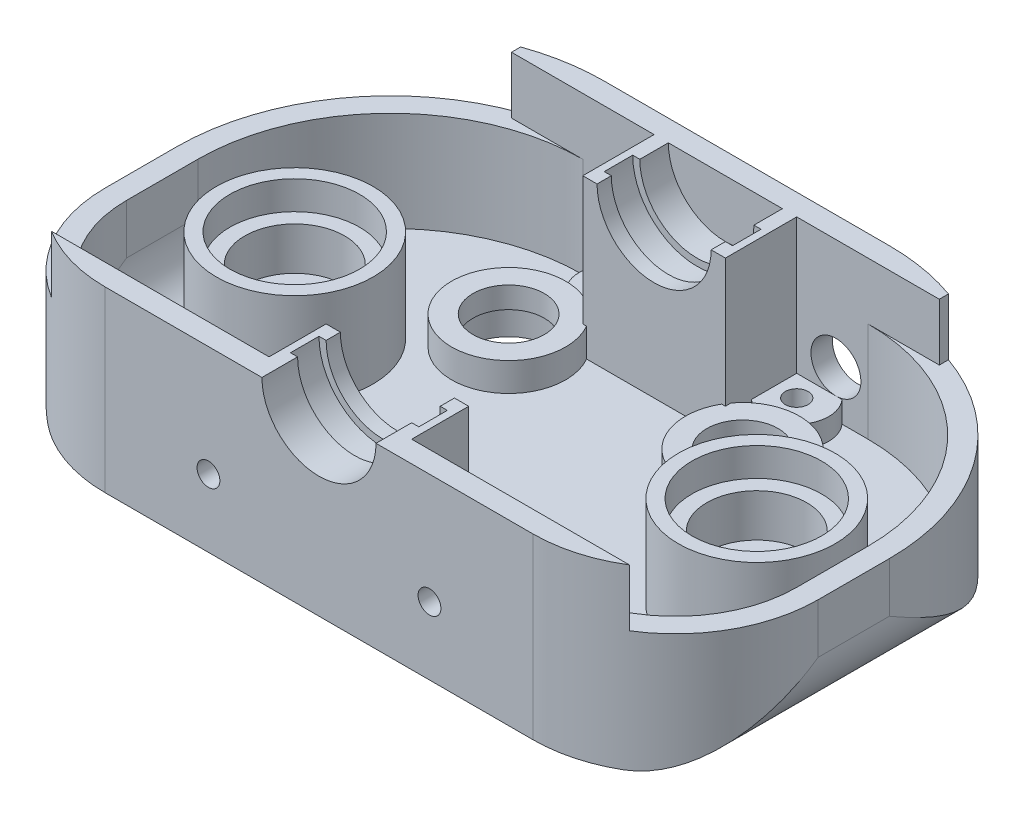
from build123d import *

# Parameters (mm, degrees)
SKETCH_1_W                = 100
SKETCH_1_H                = 60
EXTRUDE_1_DEPTH           = 25
FILLET_2_R                = 10
FILLET_1_R                = 20
FILLET_3_R                = 30
SHELL_1_T                 = -3
CUT_EXTRUDE_1_DEPTH       = 80.837334801
CUT_EXTRUDE_1_DEPTH_BACK  = 80.837334801
SKETCH_2_R                = 1.6
SKETCH_3_W                = 54
SKETCH_3_H                = 10.68528909
CUT_EXTRUDE_2_DEPTH       = 108.354552928
EXTRUDE_3_REACH           = 81.837
SKETCH_5_W                = 20
SKETCH_5_H                = 22
SKETCH_6_W                = 20
SKETCH_6_H                = 36
CUT_EXTRUDE_4_DEPTH       = 22
CUT_EXTRUDE_START         = -57
SKETCH_7_R                = 8
CUT_EXTRUDE_5_DEPTH       = 57
SKETCH_8_R                = 9
CUT_EXTRUDE_6_DEPTH       = 4
SKETCH_9_R                = 9
CUT_EXTRUDE_7_DEPTH       = 4
SKETCH_11_R               = 11
EXTRUDE_4_DEPTH           = 13
SKETCH_12_R               = 9.1
CUT_EXTRUDE_8_DEPTH       = 4
SKETCH_13_R               = 7
CUT_EXTRUDE_9_DEPTH       = 6
SKETCH_14_R               = 4.5
EXTRUDE_6_DEPTH           = 3
SKETCH_16_R               = 1.6
CUT_EXTRUDE_13_DEPTH      = 62.326992601
SKETCH_18_W               = 20
SKETCH_18_H               = 8
CUT_EXTRUDE_15_DEPTH      = 10
SKETCH_20_R               = 1.6
CUT_EXTRUDE_16_DEPTH      = 10
SKETCH_21_R               = 8
EXTRUDE_7_DEPTH           = 7
CUT_EXTRUDE_19_DEPTH      = 62.024585384
CUT_EXTRUDE_19_DEPTH_BACK = 62.024585384
SKETCH_25_R               = 5
SKETCH_26_R               = 6
CUT_EXTRUDE_20_DEPTH      = 4
SKETCH_27_R               = 3.5
CUT_EXTRUDE_21_DEPTH      = 5
CUT_EXTRUDE_14_DEPTH      = 3


with BuildPart() as part:
    # 草图1 → 凸台-拉伸1 (new body)
    with BuildSketch(Plane(origin=(0, 0, 0), x_dir=(1, 0, 0), z_dir=(0, 1, 0))):
        Rectangle(SKETCH_1_W, SKETCH_1_H)
    extrude(amount=EXTRUDE_1_DEPTH)

    # 圆角2
    fillet_2_edges = [part.edges().sort_by_distance(p)[0] for p in [
        (-50, 0, 0),
        (50, 0, 0),
    ]]
    fillet(fillet_2_edges, radius=FILLET_2_R)

    # 圆角1
    # the kernel refuses this fillet: 20 mm, written as the material it takes off along each edge
    with BuildSketch(Plane(origin=(50, -40, 30), x_dir=(0, 0, -1), z_dir=(0, 1, 0))) as fillet_1_piece_1:
        with BuildLine():
            CenterArc((FILLET_1_R, FILLET_1_R), FILLET_1_R, 180, 90)
            Line((0, FILLET_1_R), (0, 0))
            Line((0, 0), (FILLET_1_R, 0))
        make_face()
    extrude(amount=115, mode=Mode.SUBTRACT)
    with BuildSketch(Plane(origin=(-50, -40, 30), x_dir=(0, 0, -1), z_dir=(0, 1, 0))) as fillet_1_piece_2:
        with BuildLine():
            CenterArc((FILLET_1_R, -FILLET_1_R), FILLET_1_R, 90, 90)
            Line((0, -FILLET_1_R), (0, 0))
            Line((0, 0), (FILLET_1_R, 0))
        make_face()
    extrude(amount=115, mode=Mode.SUBTRACT)

    # 圆角3
    # the kernel refuses this fillet: 30 mm, written as the material it takes off along each edge
    with BuildSketch(Plane(origin=(50, -65, -30), x_dir=(-1, 0, 0), z_dir=(0, 1, 0))) as fillet_3_piece_1:
        with BuildLine():
            CenterArc((FILLET_3_R, FILLET_3_R), FILLET_3_R, 180, 90)
            Line((0, FILLET_3_R), (0, 0))
            Line((0, 0), (FILLET_3_R, 0))
        make_face()
    extrude(amount=165, mode=Mode.SUBTRACT)
    with BuildSketch(Plane(origin=(-50, -65, -30), x_dir=(1, 0, 0), z_dir=(0, 1, 0))) as fillet_3_piece_2:
        with BuildLine():
            CenterArc((FILLET_3_R, -FILLET_3_R), FILLET_3_R, 90, 90)
            Line((0, -FILLET_3_R), (0, 0))
            Line((0, 0), (FILLET_3_R, 0))
        make_face()
    extrude(amount=165, mode=Mode.SUBTRACT)

    # 抽壳1
    shell_1_openings = [part.faces().sort_by_distance(p)[0] for p in [
        (0, 25, 0.848307379),
    ]]
    offset(amount=SHELL_1_T, openings=shell_1_openings)

    # 草图2 → 切除-拉伸1 (cut, two sides: drawn at the far end of the back side and taken through both)
    with BuildSketch(Plane(origin=(0, 0, 27), x_dir=(-1, 0, 0), z_dir=(0, 0, -1)).offset(-CUT_EXTRUDE_1_DEPTH_BACK)):
        with Locations((-15.5, 9.5)):
            Circle(SKETCH_2_R)
        with Locations((15.5, 9.5)):
            Circle(SKETCH_2_R)
    extrude(amount=CUT_EXTRUDE_1_DEPTH + CUT_EXTRUDE_1_DEPTH_BACK, mode=Mode.SUBTRACT)

    # 草图3 → 切除-拉伸2 (cut, through all)
    with BuildSketch(Plane.ZY.offset(50)):
        with Locations((0, 22.342644545)):
            Rectangle(SKETCH_3_W, SKETCH_3_H)
    extrude(amount=-CUT_EXTRUDE_2_DEPTH, mode=Mode.SUBTRACT)

    # 草图5 → 凸台-拉伸3 (add, up to next)
    with BuildSketch(Plane(origin=(0, 0, 27), x_dir=(-1, 0, 0), z_dir=(0, 0, -1)), mode=Mode.PRIVATE) as extrude_3_sk1:
        with Locations((0, 14)):
            Rectangle(SKETCH_5_W, SKETCH_5_H)
    extrude_3_tool1 = extrude(extrude_3_sk1.sketch, amount=EXTRUDE_3_REACH, mode=Mode.PRIVATE) - part.part
    add(extrude_3_tool1.solids().sort_by_distance((0, 14, 27))[0])

    # 草图6 → 切除-拉伸4 (cut)
    with BuildSketch(Plane(origin=(0, 25, 0), x_dir=(1, 0, 0), z_dir=(0, 1, 0))):
        with Locations((0, -1)):
            Rectangle(SKETCH_6_W, SKETCH_6_H)
    extrude(amount=-CUT_EXTRUDE_4_DEPTH, mode=Mode.SUBTRACT)

    # 草图7 → 切除-拉伸5 (cut)
    with BuildSketch(Plane.XY.offset(30).offset(CUT_EXTRUDE_START)):
        with Locations((0, 25)):
            Circle(SKETCH_7_R)
    extrude(amount=CUT_EXTRUDE_5_DEPTH, mode=Mode.SUBTRACT)

    # 草图8 → 切除-拉伸6 (cut)
    with BuildSketch(Plane(origin=(0, 0, 25), x_dir=(-1, 0, 0), z_dir=(0, 0, -1))):
        with Locations((0, 25)):
            Circle(SKETCH_8_R)
    extrude(amount=CUT_EXTRUDE_6_DEPTH, mode=Mode.SUBTRACT)

    # 草图9 → 切除-拉伸7 (cut)
    with BuildSketch(Plane.XY.offset(-19)):
        with Locations((0, 25)):
            Circle(SKETCH_9_R)
    extrude(amount=-CUT_EXTRUDE_7_DEPTH, mode=Mode.SUBTRACT)

    # 草图11 → 凸台-拉伸4 (add)
    with BuildSketch(Plane(origin=(0, 3, 0), x_dir=(1, 0, 0), z_dir=(0, 1, 0))):
        with Locations(Location((-32.4, -1, 0), (0, 0, 133.702114437))):
            Circle(SKETCH_11_R)
        with Locations(Location((32.4, -1, 0), (0, 0, 46.297885563))):
            Circle(SKETCH_11_R)
    extrude(amount=EXTRUDE_4_DEPTH)

    # 草图12 → 切除-拉伸8 (cut)
    with BuildSketch(Plane(origin=(0, 16, 0), x_dir=(1, 0, 0), z_dir=(0, 1, 0))):
        with Locations(Location((-32.4, -1, 0), (0, 0, 270))):
            Circle(SKETCH_12_R)
        with Locations(Location((32.4, -1, 0), (0, 0, 270))):
            Circle(SKETCH_12_R)
    extrude(amount=-CUT_EXTRUDE_8_DEPTH, mode=Mode.SUBTRACT)

    # 草图13 → 切除-拉伸9 (cut)
    with BuildSketch(Plane(origin=(0, 12, 0), x_dir=(1, 0, 0), z_dir=(0, 1, 0))):
        with Locations(Location((-32.4, -1, 0), (0, 0, 270))):
            Circle(SKETCH_13_R)
        with Locations(Location((32.4, -1, 0), (0, 0, 270))):
            Circle(SKETCH_13_R)
    extrude(amount=-CUT_EXTRUDE_9_DEPTH, mode=Mode.SUBTRACT)

    # 草图14 → 凸台-拉伸6 (add)
    with BuildSketch(Plane(origin=(0, 3, 0), x_dir=(1, 0, 0), z_dir=(0, 1, 0))):
        with Locations((13, -22)):
            Circle(SKETCH_14_R)
        with Locations((-13, -22)):
            Circle(SKETCH_14_R)
        with Locations((-13, 24)):
            Circle(SKETCH_14_R)
        with Locations((13, 24)):
            Circle(SKETCH_14_R)
    extrude(amount=EXTRUDE_6_DEPTH)

    # 草图16 → 切除-拉伸13 (cut, through all)
    with BuildSketch(Plane(origin=(0, 6, 0), x_dir=(1, 0, 0), z_dir=(0, 1, 0))):
        with Locations(Location((13, -22, 0), (0, 0, 270))):
            Circle(SKETCH_16_R)
        with Locations(Location((-13, -22, 0), (0, 0, 270))):
            Circle(SKETCH_16_R)
        with Locations(Location((-13, 24, 0), (0, 0, 270))):
            Circle(SKETCH_16_R)
        with Locations(Location((13, 24, 0), (0, 0, 270))):
            Circle(SKETCH_16_R)
    extrude(amount=-CUT_EXTRUDE_13_DEPTH, mode=Mode.SUBTRACT)

    # 草图18 → 切除-拉伸15 (cut)
    with BuildSketch(Plane(origin=(0, 0, -30), x_dir=(-1, 0, 0), z_dir=(0, 0, -1))):
        with Locations((-40, 21)):
            Rectangle(SKETCH_18_W, SKETCH_18_H)
        with Locations((40, 21)):
            Rectangle(SKETCH_18_W, SKETCH_18_H)
    extrude(amount=-CUT_EXTRUDE_15_DEPTH, mode=Mode.SUBTRACT)

    # 草图20 → 切除-拉伸16 (cut)
    with BuildSketch(Plane(origin=(0, 6, 0), x_dir=(1, 0, 0), z_dir=(0, 1, 0))):
        with Locations(Location((-32.4, -1, 0), (0, 0, 270))):
            Circle(SKETCH_20_R)
        with Locations(Location((32.4, -1, 0), (0, 0, 270))):
            Circle(SKETCH_20_R)
    extrude(amount=-CUT_EXTRUDE_16_DEPTH, mode=Mode.SUBTRACT)

    # 草图21 → 凸台-拉伸7 (add)
    with BuildSketch(Plane.XZ):
        with Locations((16.4, -13)):
            Circle(SKETCH_21_R)
        with Locations((-16.4, -13)):
            Circle(SKETCH_21_R)
    extrude(amount=-EXTRUDE_7_DEPTH)

    # 草图25 → 切除-拉伸19 (cut, two sides: drawn at the far end of the back side and taken through both)
    with BuildSketch(Plane(origin=(0, 7, 0), x_dir=(1, 0, 0), z_dir=(0, 1, 0)).offset(-CUT_EXTRUDE_19_DEPTH_BACK)):
        with Locations(Location((-16.4, 13, 0), (0, 0, 270))):
            Circle(SKETCH_25_R)
        with Locations(Location((16.4, 13, 0), (0, 0, 270))):
            Circle(SKETCH_25_R)
    extrude(amount=CUT_EXTRUDE_19_DEPTH + CUT_EXTRUDE_19_DEPTH_BACK, mode=Mode.SUBTRACT)

    # 草图26 → 切除-拉伸20 (cut)
    with BuildSketch(Plane.XZ):
        with Locations(Location((-16.4, -13, 0), (0, 0, 270))):
            Circle(SKETCH_26_R)
        with Locations(Location((16.4, -13, 0), (0, 0, 270))):
            Circle(SKETCH_26_R)
    extrude(amount=-CUT_EXTRUDE_20_DEPTH, mode=Mode.SUBTRACT)

    # 草图27 → 切除-拉伸21 (cut, symmetric)
    with BuildSketch(Plane(origin=(0, 0, -30), x_dir=(-1, 0, 0), z_dir=(0, 0, -1))):
        with Locations(Location((-15.5, 9.5, 0), (0, 0, 270))):
            Circle(SKETCH_27_R)
        with Locations(Location((15.5, 9.5, 0), (0, 0, 270))):
            Circle(SKETCH_27_R)
    extrude(amount=CUT_EXTRUDE_21_DEPTH, both=True, mode=Mode.SUBTRACT)

    # 草图17 → 切除-拉伸14 (cut)
    with BuildSketch(Plane.XZ):
        Polygon((-11.337092536, 19.093443257), (-9.651394291, 21.986841736), (-11.314301755, 24.893398479), (-14.662907464, 24.906556743), (-16.348605709, 22.013158264), (-14.685698245, 19.106601521), align=None)
        Polygon((14.717616005, 19.12543419), (16.348255018, 22.050216189), (14.630639014, 24.924781999), (11.282383995, 24.87456581), (9.651744982, 21.949783811), (11.369360986, 19.075218001), align=None)
        Polygon((-11.524423993, -27.005995472), (-9.658943554, -24.225111429), (-11.134519561, -21.219115956), (-14.475576007, -20.994004528), (-16.341056446, -23.774888571), (-14.865480439, -26.780884044), align=None)
        Polygon((15.878908902, -25.710326538), (15.920640682, -22.361955025), (13.04173178, -20.651628487), (10.121091098, -22.289673462), (10.079359318, -25.638044975), (12.95826822, -27.348371513), align=None)
        Polygon((35.15530454, -0.903058124), (35.42574895, 2.434634665), (32.67044441, 4.337692789), (29.64469546, 2.903058124), (29.37425105, -0.434634665), (32.12955559, -2.337692789), align=None)
        Polygon((-29.342261545, -0.365125954), (-29.688897016, 2.965516203), (-32.746635472, 4.330642158), (-35.457738455, 2.365125954), (-35.111102984, -0.965516203), (-32.053364528, -2.330642158), align=None)
    extrude(amount=-CUT_EXTRUDE_14_DEPTH, mode=Mode.SUBTRACT)


solid = part.part
